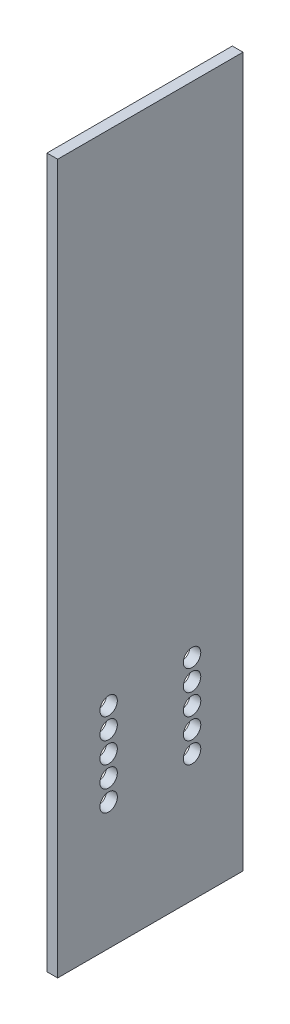
from build123d import *

# Parameters (mm, degrees)
SKETCH1_W                  = 56.4388
SKETCH1_H                  = 287.02
BOSS_EXTRUDE1_DEPTH        = 3.2512
F_4_0_209_DIAMETER_HOLE1_D = 5.3086
CUT_EXTRUDE1_REACH         = 148.294
SKETCH5_W                  = 56.4388
SKETCH5_H                  = 71.12
LPATTERN1_COUNT            = 4
LPATTERN1_PITCH            = 6.35
LPATTERN1_COL_COUNT        = 2
LPATTERN1_COL_PITCH        = 6.35


with BuildPart() as part:
    # Sketch1 → Boss-Extrude1 (new body)
    with BuildSketch(Plane(origin=(0, 0, 0), x_dir=(0, 0, -1), z_dir=(1, 0, 0))):
        Rectangle(SKETCH1_W, SKETCH1_H)
    extrude(amount=BOSS_EXTRUDE1_DEPTH)

    # #4 (0.209) Diameter Hole1 (through all)
    with Locations(Plane.ZY):
        with Locations((-12.7, -98.5012), (12.7, -98.5012)):
            f_4_0_209_diameter_hole1 = Hole(F_4_0_209_DIAMETER_HOLE1_D / 2)

    # Sketch5 → Cut-Extrude1 (cut, up to next)
    with BuildSketch(Plane.ZY, mode=Mode.PRIVATE) as cut_extrude1_sk1:
        with Locations((0, 107.95)):
            Rectangle(SKETCH5_W, SKETCH5_H)
    cut_extrude1_tool1 = extrude(cut_extrude1_sk1.sketch, amount=-CUT_EXTRUDE1_REACH, mode=Mode.PRIVATE) & part.part
    add(cut_extrude1_tool1.solids().sort_by_distance((0, 107.95, 0))[0], mode=Mode.SUBTRACT)

    # LPattern1: #4 (0.209) Diameter Hole1 ×4
    with Locations(*[(0, i * LPATTERN1_PITCH, 0) for i in range(1, LPATTERN1_COUNT)]):
        add(f_4_0_209_diameter_hole1, mode=Mode.SUBTRACT)

    # LPattern1 col: #4 (0.209) Diameter Hole1 ×2
    with Locations(*[(0, -i * LPATTERN1_COL_PITCH, 0) for i in range(1, LPATTERN1_COL_COUNT)]):
        add(f_4_0_209_diameter_hole1, mode=Mode.SUBTRACT)


solid = part.part
